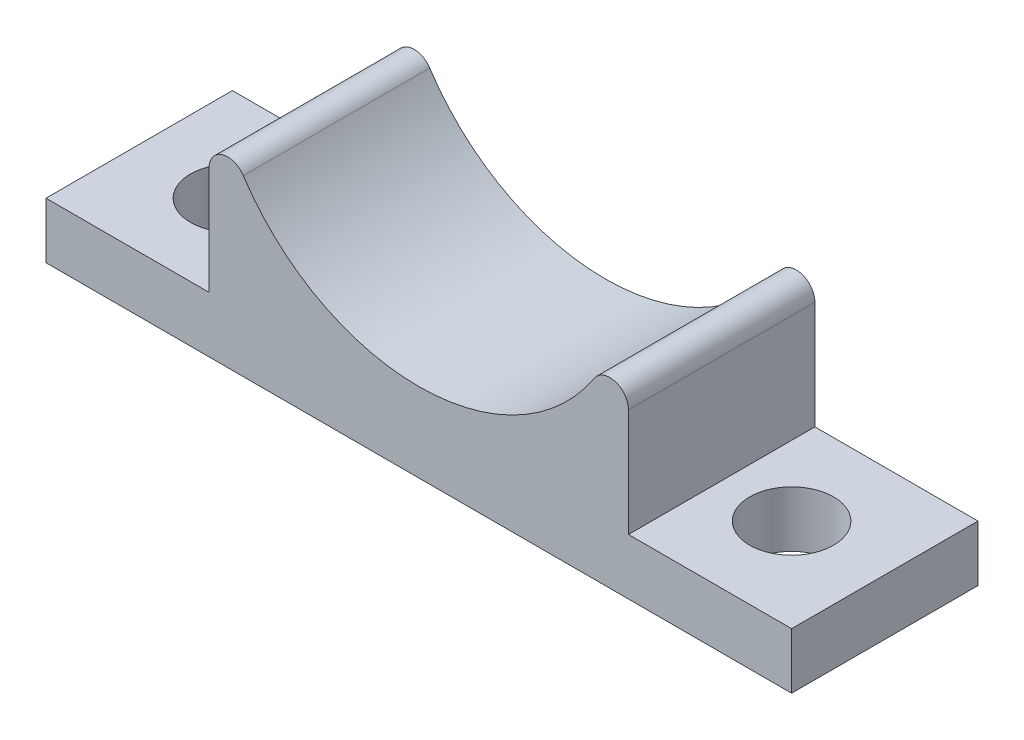
from build123d import *

# Parameters (mm, degrees)
SKETCH1_W                = 40
SKETCH1_H                = 10
BOSS_EXTRUDE1_DEPTH      = 3
BOSS_EXTRUDE2_DEPTH      = 5
BOSS_EXTRUDE2_DEPTH_BACK = 5
FILLET1_START            = -6
FILLET1_DEPTH            = 12
M4_CLEARANCE_HOLE1_D     = 4.5


with BuildPart() as part:
    # Sketch1 → Boss-Extrude1 (new body)
    with BuildSketch(Plane(origin=(0, 0, 0), x_dir=(1, 0, 0), z_dir=(0, 1, 0))):
        Rectangle(SKETCH1_W, SKETCH1_H)
    extrude(amount=BOSS_EXTRUDE1_DEPTH)

    # Sketch2 → Boss-Extrude2 (add, two sides: drawn at the far end of the back side and taken through both)
    with BuildSketch(Plane.XY.offset(-BOSS_EXTRUDE2_DEPTH_BACK)):
        with BuildLine():
            Line((11.25, 15.5), (11.25, 3))
            Line((11.25, 3), (-11.25, 3))
            Line((-11.25, 3), (-11.25, 15.5))
            ThreePointArc((-11.25, 15.5), (0, 4.25), (11.25, 15.5))
        make_face()
    extrude(amount=BOSS_EXTRUDE2_DEPTH + BOSS_EXTRUDE2_DEPTH_BACK)

    # Fillet1: read off the stored shape, not the designer's step
    # Fillet1 outline → Fillet1 (cut)
    with BuildSketch(Plane.XY.offset(FILLET1_START)):
        with BuildLine():
            ThreePointArc((11.25, 15.5), (10.781042034, 12.285714286), (9.413265306, 9.339404552))
            ThreePointArc((9.413265306, 9.339404552), (10.535714285, 9.750110915), (11.25, 8.791796068))
            Line((11.25, 8.791796068), (11.25, 15.5))
        make_face()
        with BuildLine():
            ThreePointArc((-11.25, 8.791796068), (-10.535714285, 9.750110915), (-9.413265306, 9.339404552))
            ThreePointArc((-9.413265306, 9.339404552), (-10.781042034, 12.285714286), (-11.25, 15.5))
            Line((-11.25, 15.5), (-11.25, 8.791796068))
        make_face()
    extrude(amount=FILLET1_DEPTH, mode=Mode.SUBTRACT)

    # M4 Clearance Hole1 (through all)
    with Locations(Plane(origin=(0, 0, 0), x_dir=(-1, 0, 0), z_dir=(0, -1, 0))):
        with Locations((15, 0), (-15, 0)):
            Hole(M4_CLEARANCE_HOLE1_D / 2)


solid = part.part
